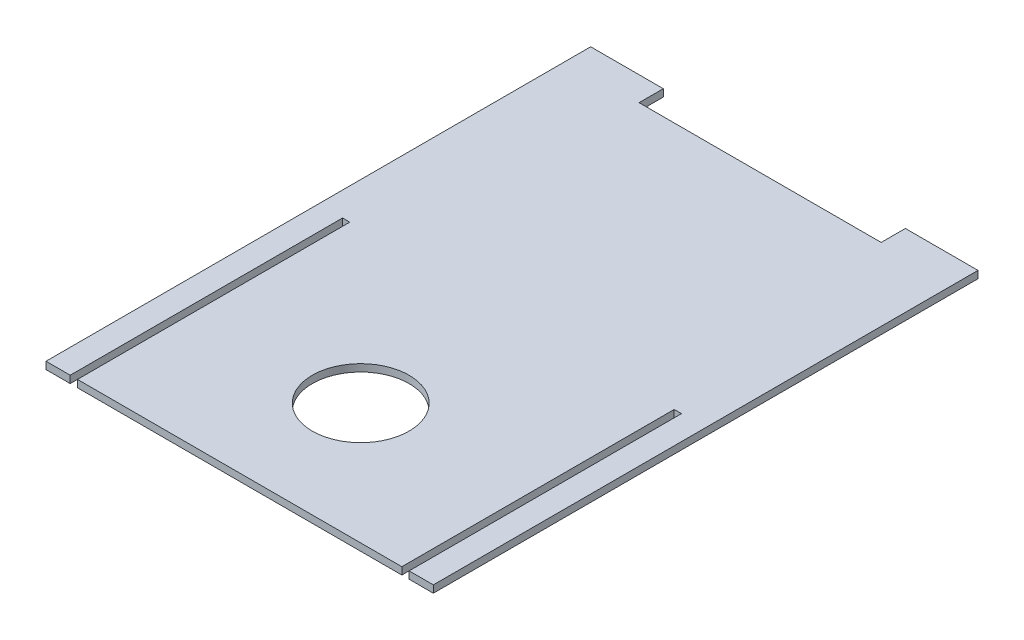
from build123d import *

# Parameters (mm, degrees)
SKETCH1_W           = 320
SKETCH1_H           = 450
BOSS_EXTRUDE1_DEPTH = 6
SKETCH2_W           = 6
SKETCH2_H           = 225
CUT_EXTRUDE1_DEPTH  = 6
LPATTERN1_COUNT     = 2
LPATTERN1_PITCH     = 274
SKETCH3_R           = 40
SKETCH3_W           = 200
SKETCH3_H           = 20
CUT_EXTRUDE2_DEPTH  = 6


with BuildPart() as part:
    # Sketch1 → Boss-Extrude1 (new body)
    with BuildSketch(Plane(origin=(0, 0, 0), x_dir=(1, 0, 0), z_dir=(0, 1, 0))):
        with Locations((160, 225)):
            Rectangle(SKETCH1_W, SKETCH1_H)
    extrude(amount=BOSS_EXTRUDE1_DEPTH)

    # Sketch2 → Cut-Extrude1 (cut)
    with BuildSketch(Plane(origin=(0, 6, 0), x_dir=(1, 0, 0), z_dir=(0, 1, 0))):
        with Locations((23, 112.5)):
            Rectangle(SKETCH2_W, SKETCH2_H)
    cut_extrude1 = extrude(amount=-CUT_EXTRUDE1_DEPTH, mode=Mode.SUBTRACT)

    # LPattern1: Cut-Extrude1 ×2
    with Locations(*[(i * LPATTERN1_PITCH, 0, 0) for i in range(1, LPATTERN1_COUNT)]):
        add(cut_extrude1, mode=Mode.SUBTRACT)

    # Sketch3 → Cut-Extrude2 (cut)
    with BuildSketch(Plane(origin=(0, 6, 0), x_dir=(1, 0, 0), z_dir=(0, 1, 0))):
        with Locations((160, 100)):
            Circle(SKETCH3_R)
        with Locations((160, 440)):
            Rectangle(SKETCH3_W, SKETCH3_H)
    extrude(amount=-CUT_EXTRUDE2_DEPTH, mode=Mode.SUBTRACT)


solid = part.part
